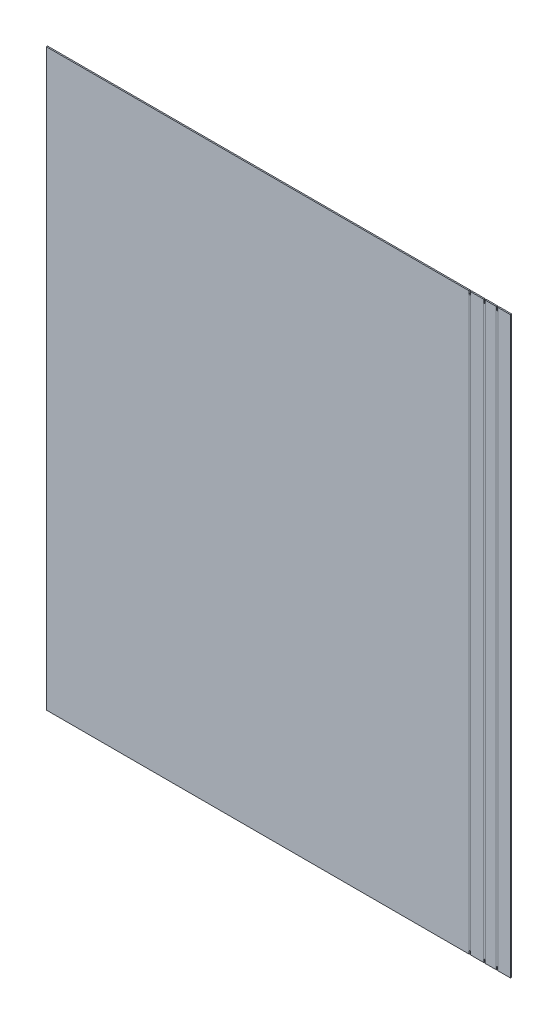
from build123d import *

# Parameters (mm, degrees)
BRIDA_BASE2_DEPTH          = 880
DESDOBLAR1_DEPTH           = 880
DESDOBLAR1_2_DEPTH         = 880
CORTAR_EXTRUIR1_DEPTH      = 961.908046857
CORTAR_EXTRUIR1_DEPTH_BACK = 961.908046857


# Read off the part's stored shape, not the designer's step: Desdoblar1
# Sheet-metal steps are written as plain solids
with BuildPart() as part:
    # Croquis55 → Brida base2 (new body)
    with BuildSketch(Plane(origin=(0, 0, 0), x_dir=(1, 0, 0), z_dir=(0, 1, 0))):
        with BuildLine():
            Line((-325, 0), (322.3634, 0))
            ThreePointArc((322.3634, 0), (324.227757739, -0.772242261), (325, -2.6366))
            Line((325, -2.6366), (325, -22.3634))
            ThreePointArc((325, -22.3634), (324.227757739, -24.227757739), (322.3634, -25))
            Line((322.3634, -25), (305.7366, -25))
            ThreePointArc((305.7366, -25), (305.215745145, -25.215745145), (305, -25.7366))
            Line((305, -25.7366), (305, -45))
            Line((305, -45), (303.1, -45))
            Line((303.1, -45), (303.1, -25.7366))
            ThreePointArc((303.1, -25.7366), (303.872242261, -23.872242261), (305.7366, -23.1))
            Line((305.7366, -23.1), (322.3634, -23.1))
            ThreePointArc((322.3634, -23.1), (322.884254855, -22.884254855), (323.1, -22.3634))
            Line((323.1, -22.3634), (323.1, -2.6366))
            ThreePointArc((323.1, -2.6366), (322.884254855, -2.115745145), (322.3634, -1.9))
            Line((322.3634, -1.9), (-325, -1.9))
            Line((-325, -1.9), (-325, 0))
        make_face()
    extrude(amount=BRIDA_BASE2_DEPTH)

    # Desdoblar1 outline → Desdoblar1 (cut)
    with BuildSketch(Plane(origin=(0, 0, 0), x_dir=(1, 0, 0), z_dir=(0, 1, 0))):
        with BuildLine():
            ThreePointArc((325, -2.6366), (324.973622072, -2.264578098), (324.895016084, -1.9))
            Line((324.895016084, -1.9), (322.3634, -1.9))
            ThreePointArc((322.3634, -1.9), (322.884254855, -2.115745145), (323.1, -2.6366))
            Line((323.1, -2.6366), (323.1, -22.3634))
            ThreePointArc((323.1, -22.3634), (322.884254855, -22.884254855), (322.3634, -23.1))
            Line((322.3634, -23.1), (305.7366, -23.1))
            ThreePointArc((305.7366, -23.1), (303.872242261, -23.872242261), (303.1, -25.7366))
            Line((303.1, -25.7366), (303.1, -45))
            Line((303.1, -45), (305, -45))
            Line((305, -45), (305, -25.7366))
            ThreePointArc((305, -25.7366), (305.215745145, -25.215745145), (305.7366, -25))
            Line((305.7366, -25), (322.3634, -25))
            ThreePointArc((322.3634, -25), (324.227757739, -24.227757739), (325, -22.3634))
            Line((325, -22.3634), (325, -2.6366))
        make_face()
    extrude(amount=DESDOBLAR1_DEPTH, mode=Mode.SUBTRACT)

    # Desdoblar1 2 outline → Desdoblar1 2 (add)
    with BuildSketch(Plane(origin=(0, 0, 0), x_dir=(1, 0, 0), z_dir=(0, 1, 0))):
        with BuildLine():
            Line((385.928315254, 0), (322.3634, 0))
            ThreePointArc((322.3634, 0), (323.946046517, -0.527835063), (324.895016084, -1.9))
            Line((324.895016084, -1.9), (385.928315254, -1.9))
            Line((385.928315254, -1.9), (385.928315254, 0))
        make_face()
    extrude(amount=DESDOBLAR1_2_DEPTH)

    # Croquis64 → Cortar-Extruir1 (cut, two sides: drawn at the far end of the back side and taken through both)
    with BuildSketch(Plane.XY.offset(1.9).offset(-CORTAR_EXTRUIR1_DEPTH_BACK)):
        with BuildLine():
            Line((322.688052542, 0), (324.688052542, 0))
            Line((324.688052542, 0), (324.688052542, 4.05))
            ThreePointArc((324.688052542, 4.05), (324.409803985, 4.721751442), (323.738052542, 5))
            Line((323.738052542, 5), (323.638052542, 5))
            ThreePointArc((323.638052542, 5), (322.9663011, 4.721751442), (322.688052542, 4.05))
            Line((322.688052542, 4.05), (322.688052542, 0))
        make_face()
        with BuildLine():
            Line((345.064157627, 0), (347.064157627, 0))
            Line((347.064157627, 0), (347.064157627, 4.05))
            ThreePointArc((347.064157627, 4.05), (346.785909069, 4.721751442), (346.114157627, 5))
            Line((346.114157627, 5), (346.014157627, 5))
            ThreePointArc((346.014157627, 5), (345.342406185, 4.721751442), (345.064157627, 4.05))
            Line((345.064157627, 4.05), (345.064157627, 0))
        make_face()
        with BuildLine():
            Line((364.340262712, 0), (366.340262712, 0))
            Line((366.340262712, 0), (366.340262712, 4.05))
            ThreePointArc((366.340262712, 4.05), (366.062014154, 4.721751442), (365.390262712, 5))
            Line((365.390262712, 5), (365.290262712, 5))
            ThreePointArc((365.290262712, 5), (364.61851127, 4.721751442), (364.340262712, 4.05))
            Line((364.340262712, 4.05), (364.340262712, 0))
        make_face()
        with BuildLine():
            Line((364.340262712, 880), (364.340262712, 875.95))
            ThreePointArc((364.340262712, 875.95), (364.61851127, 875.278248558), (365.290262712, 875))
            Line((365.290262712, 875), (365.390262712, 875))
            ThreePointArc((365.390262712, 875), (366.062014154, 875.278248558), (366.340262712, 875.95))
            Line((366.340262712, 875.95), (366.340262712, 880))
            Line((366.340262712, 880), (364.340262712, 880))
        make_face()
        with BuildLine():
            Line((345.064157627, 880), (345.064157627, 875.95))
            ThreePointArc((345.064157627, 875.95), (345.342406185, 875.278248558), (346.014157627, 875))
            Line((346.014157627, 875), (346.114157627, 875))
            ThreePointArc((346.114157627, 875), (346.785909069, 875.278248558), (347.064157627, 875.95))
            Line((347.064157627, 875.95), (347.064157627, 880))
            Line((347.064157627, 880), (345.064157627, 880))
        make_face()
        with BuildLine():
            Line((322.688052542, 880), (322.688052542, 875.95))
            ThreePointArc((322.688052542, 875.95), (322.9663011, 875.278248558), (323.638052542, 875))
            Line((323.638052542, 875), (323.738052542, 875))
            ThreePointArc((323.738052542, 875), (324.409803985, 875.278248558), (324.688052542, 875.95))
            Line((324.688052542, 875.95), (324.688052542, 880))
            Line((324.688052542, 880), (322.688052542, 880))
        make_face()
    extrude(amount=CORTAR_EXTRUIR1_DEPTH + CORTAR_EXTRUIR1_DEPTH_BACK, mode=Mode.SUBTRACT)


solid = part.part
